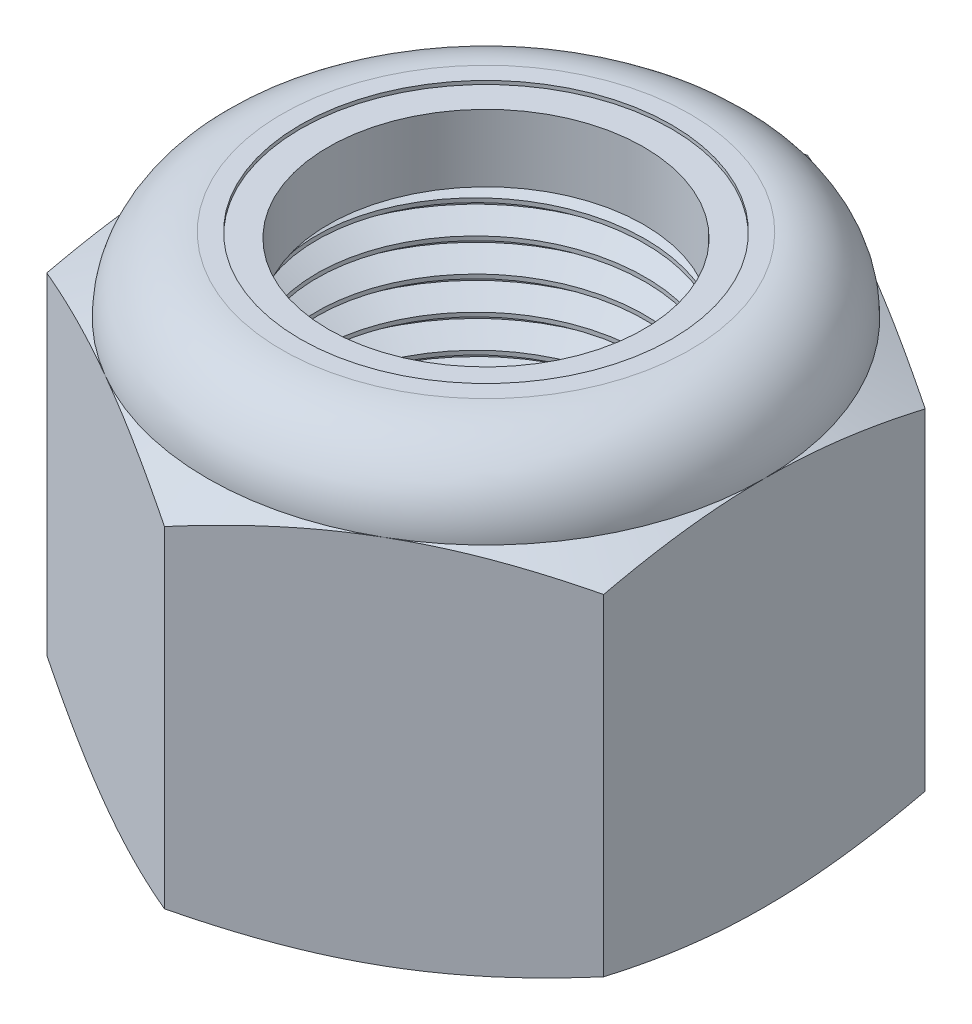
from build123d import *

# Parameters (mm, degrees)
SKETCH1_R        = 7.9375
EXTRUDE1_DEPTH   = 19.05
SKETCH2_W        = 7.9375
SKETCH2_H        = 15.875
CUT_SWEEP1_PITCH = 1.411111111
SKETCH12_W       = 8.73125
SKETCH12_H       = 15.875


with BuildPart() as part:
    # Sketch1 → Extrude1 (new body)
    with BuildSketch(Plane(origin=(0, 0, 0), x_dir=(1, 0, 0), z_dir=(0, 1, 0))):
        Polygon((0, 13.748153285), (-11.90625, 6.874076643), (-11.90625, -6.874076643), (0, -13.748153285), (11.90625, -6.874076643), (11.90625, 6.874076643), align=None)
        with Locations(Location((0, 0, 0), (0, 0, 90))):
            Circle(SKETCH1_R, mode=Mode.SUBTRACT)
    extrude(amount=EXTRUDE1_DEPTH)

    # Sketch5 → Cut-Revolve3 (revolve, cut)
    with BuildSketch(Plane(origin=(0, 0, 0), x_dir=(0, 0, -1), z_dir=(1, 0, 0))):
        with BuildLine():
            Line((0, 0), (11.90625, 0))
            Line((11.90625, 0), (13.748153285, 0.858893607))
            Line((13.748153285, 0.858893607), (13.748153285, 15.016106393))
            Line((13.748153285, 15.016106393), (11.90625, 15.875))
            ThreePointArc((11.90625, 15.875), (10.97631403, 18.12006403), (8.73125, 19.05))
            Line((8.73125, 19.05), (8.73125, 20.32))
            Line((8.73125, 20.32), (15.018153285, 20.32))
            Line((15.018153285, 20.32), (15.018153285, -1.27))
            Line((15.018153285, -1.27), (0, -1.27))
            Line((0, -1.27), (0, 0))
        make_face()
    revolve(axis=Axis((0, 0, 0), (0, 1, 0)), mode=Mode.SUBTRACT)

    # Sketch6 → Cut-Revolve4 (revolve, cut)
    with BuildSketch(Plane(origin=(0, 0, 0), x_dir=(0, 0, -1), z_dir=(1, 0, 0))):
        with BuildLine():
            Line((0, 15.875), (11.75385, 15.875))
            ThreePointArc((11.75385, 15.875), (10.868550957, 18.012300957), (8.73125, 18.8976))
            Line((8.73125, 18.8976), (4.365625, 18.8976))
            Line((4.365625, 18.8976), (4.365625, 20.32))
            Line((4.365625, 20.32), (0, 20.32))
            Line((0, 20.32), (0, 15.875))
        make_face()
    revolve(axis=Axis((0, 20.32, 0), (0, -1, 0)), mode=Mode.SUBTRACT)

    # Sketch4 → Cut-Revolve2 (revolve, cut)
    with BuildSketch(Plane(origin=(0, 0, 0), x_dir=(0, 0, -1), z_dir=(1, 0, 0))):
        Polygon((0, 15.875), (8.73125, 15.875), (0, 11.80355126), align=None)
        Polygon((0, 4.07144874), (8.73125, 0), (0, 0), align=None)
    revolve(axis=Axis((0, 0, 0), (0, 1, 0)), mode=Mode.SUBTRACT)

    # Sketch12 → Revolve4 (revolve)
    with BuildSketch(Plane(origin=(0, 0, 0), x_dir=(0, 0, -1), z_dir=(1, 0, 0)), mode=Mode.PRIVATE) as revolve4_sk:
        with Locations((4.365625, 7.9375)):
            Rectangle(SKETCH12_W, SKETCH12_H)
    revolve(revolve4_sk.sketch.rotate(Axis((0, 0, 0), (0, 1, 0)), 180), axis=Axis((0, 0, 0), (0, 1, 0)))


with BuildPart() as body_2:
    # Sketch7 → Revolve2 (revolve)
    with BuildSketch(Plane(origin=(0, 0, 0), x_dir=(0, 0, -1), z_dir=(1, 0, 0))):
        with BuildLine():
            Line((6.746875, 15.9512), (11.67666449, 15.9512))
            ThreePointArc((11.67666449, 15.9512), (10.787552176, 17.985188219), (8.73125, 18.8214))
            Line((8.73125, 18.8214), (6.746875, 18.8214))
            Line((6.746875, 18.8214), (6.746875, 15.9512))
        make_face()
    revolve(axis=Axis((0, 15.9512, 0), (0, 1, 0)))


with BuildPart() as body_3:
    # Sketch2 → Revolve1 (revolve)
    with BuildSketch(Plane(origin=(0, 0, 0), x_dir=(0, 0, -1), z_dir=(1, 0, 0)), mode=Mode.PRIVATE) as revolve1_sk:
        with Locations((3.96875, 7.9375)):
            Rectangle(SKETCH2_W, SKETCH2_H)
    revolve(revolve1_sk.sketch.rotate(Axis((0, -7.9375, 0), (0, 1, 0)), 180), axis=Axis((0, -7.9375, 0), (0, 1, 0)))

    # Cut-Sweep1: the profile of Sketch9 screwed along a right-hand helix of 14.5 turns, 8 arcs to a turn; built about Z, then put on its axis
    cut_sweep1_z = Axis((0, 0, 0), (0, 0, 1))
    cut_sweep1_corners = [(8.090257259, 0, 0.088194444), (8.013878629, 0, -1.278819444), (7.020956448, 0, -0.705555556), (7.020956448, 0, -0.529166667)]
    with BuildLine(mode=Mode.PRIVATE) as cut_sweep1_profile:
        Line(cut_sweep1_corners[0], cut_sweep1_corners[1])
        Line(cut_sweep1_corners[1], cut_sweep1_corners[2])
        Line(cut_sweep1_corners[2], cut_sweep1_corners[3])
        Line(cut_sweep1_corners[3], cut_sweep1_corners[0])
    cut_sweep1_cap = Face(cut_sweep1_profile.wire())
    cut_sweep1_turn_angles = [0, 22.5, 45, 67.5, 90, 112.5, 135, 157.5, 180, 202.5, 225, 247.5, 270, 292.5, 315, 337.5, 360]
    cut_sweep1_turn_weights = [1, 0.9238795325112867, 1, 0.9238795325112867, 1, 0.9238795325112867, 1, 0.9238795325112867, 1, 0.9238795325112867, 1, 0.9238795325112867, 1, 0.9238795325112867, 1, 0.9238795325112867, 1]
    cut_sweep1_turn_rails = [Edge.make_bspline([Vector(p[0], p[1], 0).rotate(cut_sweep1_z, cut_sweep1_turn_angles[k]) / cut_sweep1_turn_weights[k] + Vector(0, 0, p[2] + CUT_SWEEP1_PITCH * cut_sweep1_turn_angles[k] / 360) for k in range(17)], [0, 0, 0, 1, 1, 2, 2, 3, 3, 4, 4, 5, 5, 6, 6, 7, 7, 8, 8, 8], 2, cut_sweep1_turn_weights) for p in cut_sweep1_corners]
    cut_sweep1_turn_sides = [Face.make_surface_from_curves(cut_sweep1_turn_rails[p[0]], cut_sweep1_turn_rails[p[1]]) for p in [(0, 1), (1, 2), (2, 3), (3, 0)]]
    cut_sweep1_last_angles = [5040, 5062.5, 5085, 5107.5, 5130, 5152.5, 5175, 5197.5, 5220]
    cut_sweep1_last_weights = [1, 0.9238795325112867, 1, 0.9238795325112867, 1, 0.9238795325112867, 1, 0.9238795325113627, 1]
    cut_sweep1_last_rails = [Edge.make_bspline([Vector(p[0], p[1], 0).rotate(cut_sweep1_z, cut_sweep1_last_angles[k]) / cut_sweep1_last_weights[k] + Vector(0, 0, p[2] + CUT_SWEEP1_PITCH * cut_sweep1_last_angles[k] / 360) for k in range(9)], [0, 0, 0, 1, 1, 2, 2, 3, 3, 4, 4, 4], 2, cut_sweep1_last_weights) for p in cut_sweep1_corners]
    cut_sweep1_last_sides = [Face.make_surface_from_curves(cut_sweep1_last_rails[p[0]], cut_sweep1_last_rails[p[1]]) for p in [(0, 1), (1, 2), (2, 3), (3, 0)]]
    cut_sweep1 = Plane(origin=(0, 15.875, 0), x_dir=(0, 0, -1), z_dir=(0, -1, 0)) * Solid(Shell([*[p.moved(Location((0, 0, CUT_SWEEP1_PITCH * i))) for i in range(14) for p in cut_sweep1_turn_sides], *cut_sweep1_last_sides, cut_sweep1_cap, cut_sweep1_cap.rotate(cut_sweep1_z, 5220).moved(Location((0, 0, CUT_SWEEP1_PITCH * 5220 / 360)))]))
    add(cut_sweep1, mode=Mode.SUBTRACT)

    # Sketch11 → Revolve3 (revolve)
    with BuildSketch(Plane(origin=(0, 0, 0), x_dir=(0, 0, -1), z_dir=(1, 0, 0)), mode=Mode.PRIVATE) as revolve3_sk:
        Polygon((0, 0), (8.73125, 0), (0, 4.07144874), align=None)
    revolve(revolve3_sk.sketch.rotate(Axis((0, 19.05, 0), (0, -1, 0)), 355.401602057), axis=Axis((0, 19.05, 0), (0, -1, 0)))


with BuildPart() as part_1:
    add(part.part)

    # Combine1: cut body 3
    add(body_3.part, mode=Mode.SUBTRACT)


solid = Compound([body_2.part, part_1.part])
